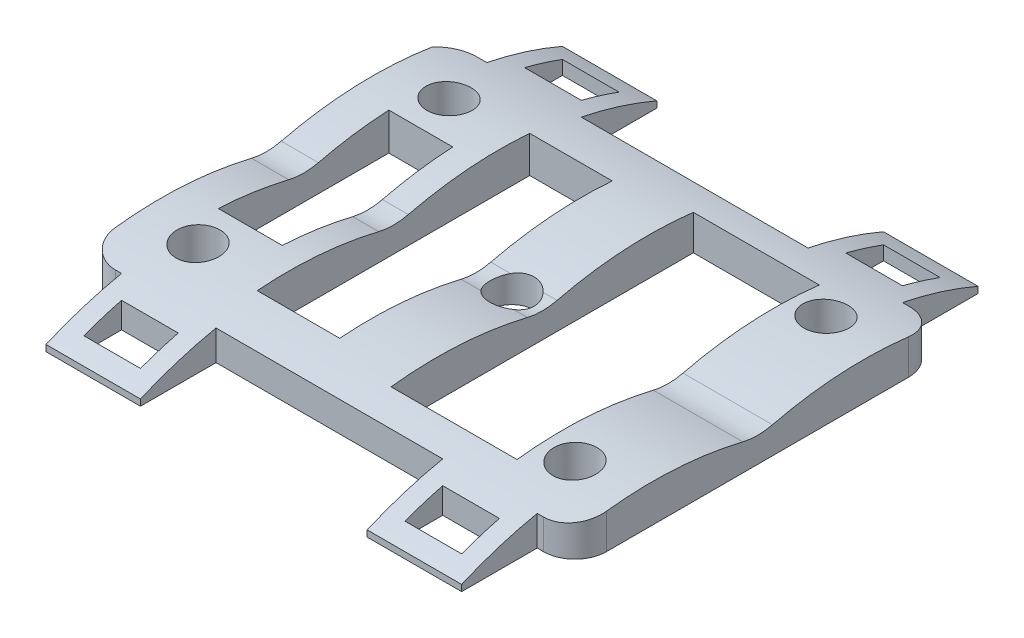
from build123d import *

# Parameters (mm, degrees)
SKETCH1_W           = 9
SKETCH1_H           = 6
BOSS_EXTRUDE1_DEPTH = 8
SKETCH7_R           = 3.5
CUT_EXTRUDE6_DEPTH  = 58.148928249
SKETCH8_W           = 20
SKETCH8_H           = 48
SKETCH8_W_2         = 13.097757945
SKETCH8_H_2         = 43.270168554
SKETCH8_W_3         = 10.15485161
SKETCH8_H_3         = 27.078052584
CUT_EXTRUDE7_DEPTH  = 58.148928249
CUT_EXTRUDE8_DEPTH  = 89.481636513


with BuildPart() as part:
    # Sketch1 → Boss-Extrude1 (new body)
    with BuildSketch(Plane(origin=(0, 0, 0), x_dir=(1, 0, 0), z_dir=(0, 1, 0))):
        with BuildLine():
            Line((-18, -41), (-18, -29))
            Line((-18, -29), (18, -29))
            Line((18, -29), (18, -41))
            Line((18, -41), (33, -41))
            Line((33, -41), (33, -29))
            Line((33, -29), (34, -29))
            ThreePointArc((34, -29), (37.535533906, -27.535533906), (39, -24))
            Line((39, -24), (39, 24))
            ThreePointArc((39, 24), (37.535533906, 27.535533906), (34, 29))
            Line((34, 29), (33, 29))
            Line((33, 29), (33, 41))
            Line((33, 41), (18, 41))
            Line((18, 41), (18, 29))
            Line((18, 29), (-18, 29))
            Line((-18, 29), (-18, 41))
            Line((-18, 41), (-33, 41))
            Line((-33, 41), (-33, 29))
            Line((-33, 29), (-34.521759717, 29))
            ThreePointArc((-34.521759717, 29), (-37.156234318, 28.249652171), (-39, 26.223817431))
            Line((-39, 26.223817431), (-39, -24))
            ThreePointArc((-39, -24), (-37.535533906, -27.535533906), (-34, -29))
            Line((-34, -29), (-33, -29))
            Line((-33, -29), (-33, -41))
            Line((-33, -41), (-18, -41))
        make_face()
        with Locations((-25.5, -35)):
            Rectangle(SKETCH1_W, SKETCH1_H, mode=Mode.SUBTRACT)
        with Locations((-25.5, 35)):
            Rectangle(SKETCH1_W, SKETCH1_H, mode=Mode.SUBTRACT)
        with Locations((25.5, 35)):
            Rectangle(SKETCH1_W, SKETCH1_H, mode=Mode.SUBTRACT)
        with Locations((25.5, -35)):
            Rectangle(SKETCH1_W, SKETCH1_H, mode=Mode.SUBTRACT)
    extrude(amount=BOSS_EXTRUDE1_DEPTH)

    # Sketch7 → Cut-Extrude6 (cut, through all)
    with BuildSketch(Plane.XZ):
        with Locations((-29.928932188, 19.928932188)):
            Circle(SKETCH7_R)
        with Locations((29.928932188, 19.928932188)):
            Circle(SKETCH7_R)
        with Locations((-29.928932188, -19.928932188)):
            Circle(SKETCH7_R)
        with Locations((29.928932188, -19.928932188)):
            Circle(SKETCH7_R)
        Circle(SKETCH7_R)
    extrude(amount=-CUT_EXTRUDE6_DEPTH, mode=Mode.SUBTRACT)

    # Sketch8 → Cut-Extrude7 (cut, through all)
    with BuildSketch(Plane.XZ):
        with Locations((14.79514858, 0)):
            Rectangle(SKETCH8_W, SKETCH8_H)
        with Locations((-12.271480844, 0)):
            Rectangle(SKETCH8_W_2, SKETCH8_H_2)
        with Locations((-28.019388054, 0)):
            Rectangle(SKETCH8_W_3, SKETCH8_H_3)
    extrude(amount=-CUT_EXTRUDE7_DEPTH, mode=Mode.SUBTRACT)

    # Sketch9 → Cut-Extrude8 (cut, through all)
    with BuildSketch(Plane.ZY.offset(39)):
        with BuildLine():
            Line((-41, 1), (-41, 8))
            Line((-41, 8), (41, 8))
            Line((41, 8), (41, 1))
            ThreePointArc((41, 1), (21.942955264, 5.780514085), (2.352782097, 4.280719347))
            ThreePointArc((2.352782097, 4.280719347), (0, 4), (-2.352782097, 4.280719347))
            ThreePointArc((-2.352782097, 4.280719347), (-21.942955264, 5.780514085), (-41, 1))
        make_face()
    extrude(amount=-CUT_EXTRUDE8_DEPTH, mode=Mode.SUBTRACT)


solid = part.part
